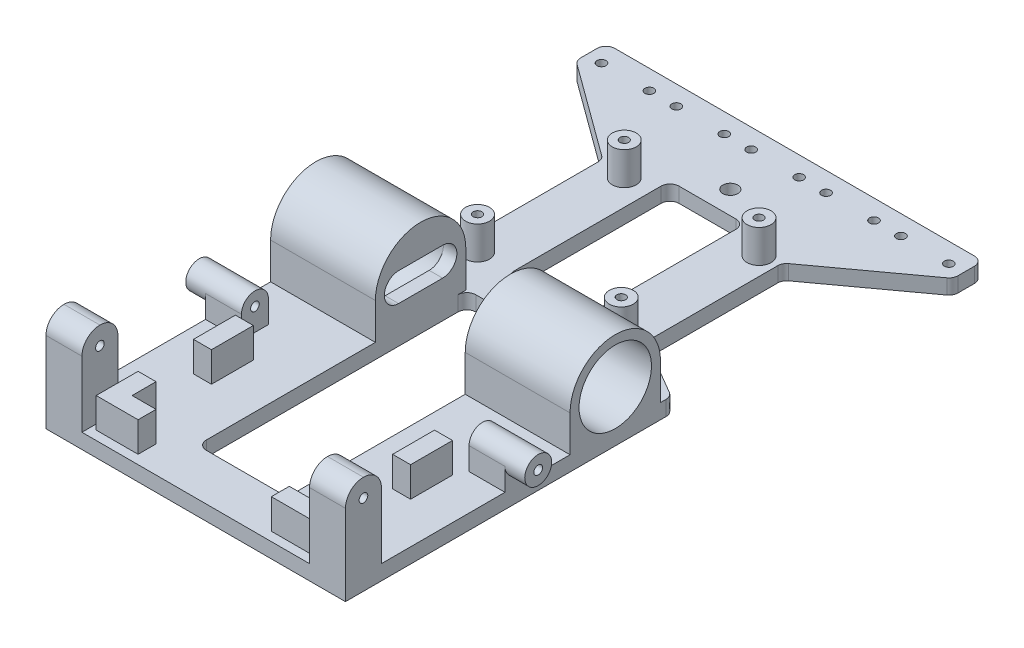
from build123d import *

# Parameters (mm, degrees)
SKETCH1_R             = 2.5
SKETCH1_W             = 30
SKETCH1_H             = 90
SKETCH1_W_2           = 25
SKETCH1_H_2           = 55
BOSS_EXTRUDE1_DEPTH   = 5
FILLET1_R             = 3
SKETCH3_W             = 35
SKETCH3_H             = 30.2
BOSS_EXTRUDE2_DEPTH   = 27.2
CUT_EXTRUDE1_DEPTH    = 35
SKETCH4_3_R           = 12.1
CUT_EXTRUDE2_DEPTH    = 30.5
CUT_EXTRUDE3_DEPTH    = 35
SKETCH6_W             = 12
SKETCH6_H             = 9
BOSS_EXTRUDE3_DEPTH   = 12
FILLET2_R             = 4.5
SKETCH9_R             = 4.5
BOSS_EXTRUDE5_DEPTH   = 6.6
SKETCH10_R            = 1.45
CUT_EXTRUDE5_DEPTH    = 18.6
FILLET2_OF_MIRROR11_R = 4.5
SKETCH11_W            = 12
SKETCH11_H            = 12
BOSS_EXTRUDE6_DEPTH   = 28
FILLET3_R             = 6
SKETCH12_R            = 1.45
CUT_EXTRUDE6_DEPTH    = 12
FILLET3_OF_MIRROR12_R = 6
SKETCH13_R            = 4
SKETCH13_R_2          = 1.45
BOSS_EXTRUDE7_DEPTH   = 11
BOSS_EXTRUDE8_DEPTH   = 10
SKETCH16_W            = 6
SKETCH16_H            = 14
BOSS_EXTRUDE9_DEPTH   = 10
CUT_EXTRUDE7_REACH    = 123.462
SKETCH17_R            = 1.5


with BuildPart() as part:
    # Sketch1 → Boss-Extrude1 (new body)
    with BuildSketch(Plane(origin=(0, 0, 0), x_dir=(1, 0, 0), z_dir=(0, 1, 0))):
        Polygon((-50, -100), (50, -100), (50, -50), (50, -35), (50, 8.781570318), (30, 20.44204843), (30, 65.896231008), (63, 90), (63, 100), (50, 100), (-50, 100), (-63, 100), (-63, 90), (-30, 65.896231008), (-30, 20.44204843), (-50, 8.781570318), (-50, -35), (-50, -50), align=None)
        with Locations(Location((0, 78.520352636, 0), (0, 0, 270))):
            Circle(SKETCH1_R, mode=Mode.SUBTRACT)
        with Locations((0, -39.461257299)):
            Rectangle(SKETCH1_W, SKETCH1_H, mode=Mode.SUBTRACT)
        with Locations((0, 43.381236072)):
            Rectangle(SKETCH1_W_2, SKETCH1_H_2, mode=Mode.SUBTRACT)
    extrude(amount=BOSS_EXTRUDE1_DEPTH)

    # Fillet1
    fillet1_edges = [part.edges().sort_by_distance(p)[0] for p in [
        (63, 2.5, -100),
        (63, 2.5, -90),
        (30, 2.5, -65.896231008),
        (30, 2.5, -20.44204843),
        (50, 2.5, -8.781570318),
        (-50, 2.5, -8.781570318),
        (-30, 2.5, -20.44204843),
        (-30, 2.5, -65.896231008),
        (-63, 2.5, -90),
        (-63, 2.5, -100),
        (15, 2.5, 84.461257299),
        (15, 2.5, -5.538742701),
        (-15, 2.5, -5.538742701),
        (-15, 2.5, 84.461257299),
        (12.5, 2.5, -15.881236072),
        (12.5, 2.5, -70.881236072),
        (-12.5, 2.5, -70.881236072),
        (-12.5, 2.5, -15.881236072),
    ]]
    fillet(fillet1_edges, radius=FILLET1_R)

    # Sketch3 → Boss-Extrude2 (add)
    with BuildSketch(Plane(origin=(0, 5, 0), x_dir=(1, 0, 0), z_dir=(0, 1, 0))):
        with Locations((-32.5, -9.9)):
            Rectangle(SKETCH3_W, SKETCH3_H)
    boss_extrude2 = extrude(amount=BOSS_EXTRUDE2_DEPTH)

    # Sketch4 → Cut-Extrude1 (cut)
    with BuildSketch(Plane.ZY.offset(50)):
        with BuildLine():
            Line((-5.2, 32.2), (-5.2, 17.1))
            ThreePointArc((-5.2, 17.1), (-0.777312396, 27.777312396), (9.9, 32.2))
            Line((9.9, 32.2), (-5.2, 32.2))
        make_face()
        with BuildLine():
            Line((25, 32.2), (9.9, 32.2))
            ThreePointArc((9.9, 32.2), (20.577312396, 27.777312396), (25, 17.1))
            Line((25, 17.1), (25, 32.2))
        make_face()
    cut_extrude1 = extrude(amount=-CUT_EXTRUDE1_DEPTH, mode=Mode.SUBTRACT)

    # Sketch4<3> → Cut-Extrude2 (cut)
    with BuildSketch(Plane.ZY.offset(50)):
        with Locations((9.9, 17.1)):
            Circle(SKETCH4_3_R)
    cut_extrude2 = extrude(amount=-CUT_EXTRUDE2_DEPTH, mode=Mode.SUBTRACT)

    # Sketch4<4> → Cut-Extrude3 (cut)
    with BuildSketch(Plane.ZY.offset(50)):
        with BuildLine():
            Line((2.55, 21.85), (17.25, 21.85))
            ThreePointArc((17.25, 21.85), (22, 17.1), (17.25, 12.35))
            Line((17.25, 12.35), (2.55, 12.35))
            ThreePointArc((2.55, 12.35), (-2.2, 17.1), (2.55, 21.85))
        make_face()
    cut_extrude3 = extrude(amount=-CUT_EXTRUDE3_DEPTH, mode=Mode.SUBTRACT)

    # Mirror9: Boss-Extrude2, Cut-Extrude1, Cut-Extrude2, Cut-Extrude3 across plane
    add(boss_extrude2.mirror(Plane(origin=(0, 0, 0), x_dir=(0, 0, 1), z_dir=(1, 0, 0))))
    add(cut_extrude1.mirror(Plane(origin=(0, 0, 0), x_dir=(0, 0, 1), z_dir=(1, 0, 0))), mode=Mode.SUBTRACT)
    add(cut_extrude2.mirror(Plane(origin=(0, 0, 0), x_dir=(0, 0, 1), z_dir=(1, 0, 0))), mode=Mode.SUBTRACT)
    add(cut_extrude3.mirror(Plane(origin=(0, 0, 0), x_dir=(0, 0, 1), z_dir=(1, 0, 0))), mode=Mode.SUBTRACT)

    # Sketch6 → Boss-Extrude3 (add)
    with BuildSketch(Plane(origin=(0, 5, 0), x_dir=(1, 0, 0), z_dir=(0, 1, 0))):
        with Locations((-44, -42.231514294)):
            Rectangle(SKETCH6_W, SKETCH6_H)
    boss_extrude3 = extrude(amount=BOSS_EXTRUDE3_DEPTH)

    # Fillet2
    fillet2_edges = [part.edges().sort_by_distance(p)[0] for p in [
        (-44, 17, 37.731514294),
        (-44, 17, 46.731514294),
    ]]
    fillet(fillet2_edges, radius=FILLET2_R - 0.0001)  # a hair under: the kernel refuses the full size

    # Sketch9 → Boss-Extrude5 (add)
    with BuildSketch(Plane.ZY.offset(50)):
        with Locations((42.231514294, 12.5)):
            Circle(SKETCH9_R)
    boss_extrude5 = extrude(amount=BOSS_EXTRUDE5_DEPTH)

    # Sketch10 → Cut-Extrude5 (cut)
    with BuildSketch(Plane.ZY.offset(56.6)):
        with Locations((42.231514294, 12.5)):
            Circle(SKETCH10_R)
    cut_extrude5 = extrude(amount=-CUT_EXTRUDE5_DEPTH, mode=Mode.SUBTRACT)

    # Mirror11: Boss-Extrude3, Boss-Extrude5, Cut-Extrude5 across plane
    add(boss_extrude3.mirror(Plane(origin=(0, 0, 0), x_dir=(0, 0, 1), z_dir=(1, 0, 0))))
    add(boss_extrude5.mirror(Plane(origin=(0, 0, 0), x_dir=(0, 0, 1), z_dir=(1, 0, 0))))
    add(cut_extrude5.mirror(Plane(origin=(0, 0, 0), x_dir=(0, 0, 1), z_dir=(1, 0, 0))), mode=Mode.SUBTRACT)

    # Fillet2 of Mirror11
    fillet2_of_mirror11_edges = [part.edges().sort_by_distance(p)[0] for p in [
        (44, 17, 37.731514294),
        (44, 17, 46.731514294),
    ]]
    fillet(fillet2_of_mirror11_edges, radius=FILLET2_OF_MIRROR11_R - 0.0001)  # a hair under: the kernel refuses the full size

    # Sketch11 → Boss-Extrude6 (add)
    with BuildSketch(Plane(origin=(0, 5, 0), x_dir=(1, 0, 0), z_dir=(0, 1, 0))):
        with Locations((-44, -94)):
            Rectangle(SKETCH11_W, SKETCH11_H)
    boss_extrude6 = extrude(amount=BOSS_EXTRUDE6_DEPTH)

    # Fillet3
    fillet3_edges = [part.edges().sort_by_distance(p)[0] for p in [
        (-44, 33, 88),
        (-44, 33, 100),
    ]]
    fillet(fillet3_edges, radius=FILLET3_R - 0.0001)  # a hair under: the kernel refuses the full size

    # Sketch12 → Cut-Extrude6 (cut)
    with BuildSketch(Plane.ZY.offset(50)):
        with Locations((94, 27)):
            Circle(SKETCH12_R)
    cut_extrude6 = extrude(amount=-CUT_EXTRUDE6_DEPTH, mode=Mode.SUBTRACT)

    # Mirror12: Boss-Extrude6, Cut-Extrude6 across plane
    add(boss_extrude6.mirror(Plane(origin=(0, 0, 0), x_dir=(0, 0, 1), z_dir=(1, 0, 0))))
    add(cut_extrude6.mirror(Plane(origin=(0, 0, 0), x_dir=(0, 0, 1), z_dir=(1, 0, 0))), mode=Mode.SUBTRACT)

    # Fillet3 of Mirror12
    fillet3_of_mirror12_edges = [part.edges().sort_by_distance(p)[0] for p in [
        (44, 33, 88),
        (44, 33, 100),
    ]]
    fillet(fillet3_of_mirror12_edges, radius=FILLET3_OF_MIRROR12_R - 0.0001)  # a hair under: the kernel refuses the full size

    # Sketch13 → Boss-Extrude7 (add)
    # profile 1 of 4: a face of its own
    with BuildSketch(Plane(origin=(0, 5, 0), x_dir=(1, 0, 0), z_dir=(0, 1, 0))):
        with Locations(Location((-23.995, 18.108314646, 0), (0, 0, 270))):
            Circle(SKETCH13_R)
        with Locations(Location((-23.995, 18.108314646, 0), (0, 0, 270))):
            Circle(SKETCH13_R_2, mode=Mode.SUBTRACT)
    # profile 2 of 4: a face of its own
    with BuildSketch(Plane(origin=(0, 5, 0), x_dir=(1, 0, 0), z_dir=(0, 1, 0))):
        with Locations(Location((24.005, 18.108314646, 0), (0, 0, 270))):
            Circle(SKETCH13_R)
        with Locations(Location((24.005, 18.108314646, 0), (0, 0, 270))):
            Circle(SKETCH13_R_2, mode=Mode.SUBTRACT)
    # profile 3 of 4: a face of its own
    with BuildSketch(Plane(origin=(0, 5, 0), x_dir=(1, 0, 0), z_dir=(0, 1, 0))):
        with Locations(Location((-20.995, 64.108314646, 0), (0, 0, 270))):
            Circle(SKETCH13_R)
        with Locations(Location((-20.995, 64.108314646, 0), (0, 0, 270))):
            Circle(SKETCH13_R_2, mode=Mode.SUBTRACT)
    # profile 4 of 4: a face of its own
    with BuildSketch(Plane(origin=(0, 5, 0), x_dir=(1, 0, 0), z_dir=(0, 1, 0))):
        with Locations(Location((24.005, 64.108314646, 0), (0, 0, 270))):
            Circle(SKETCH13_R)
        with Locations(Location((24.005, 64.108314646, 0), (0, 0, 270))):
            Circle(SKETCH13_R_2, mode=Mode.SUBTRACT)
    extrude(amount=BOSS_EXTRUDE7_DEPTH)

    # Sketch15 → Boss-Extrude8 (add)
    with BuildSketch(Plane(origin=(0, 5, 0), x_dir=(1, 0, 0), z_dir=(0, 1, 0))):
        Polygon((-30.25, -91), (-22.25, -91), (-22.25, -97), (-36.25, -97), (-36.25, -83), (-30.25, -83), align=None)
    boss_extrude8 = extrude(amount=BOSS_EXTRUDE8_DEPTH)

    # Mirror13: Boss-Extrude8 across plane
    add(boss_extrude8.mirror(Plane(origin=(0, 0, 0), x_dir=(0, 0, 1), z_dir=(1, 0, 0))))

    # Sketch16 → Boss-Extrude9 (add)
    with BuildSketch(Plane(origin=(0, 5, 0), x_dir=(1, 0, 0), z_dir=(0, 1, 0))):
        with Locations((-33.25, -57.5)):
            Rectangle(SKETCH16_W, SKETCH16_H)
    boss_extrude9 = extrude(amount=BOSS_EXTRUDE9_DEPTH)

    # Mirror14: Boss-Extrude9 across plane
    add(boss_extrude9.mirror(Plane(origin=(0, 0, 0), x_dir=(0, 0, 1), z_dir=(1, 0, 0))))

    # Sketch17 → Cut-Extrude7 (cut, up to next)
    with BuildSketch(Plane(origin=(0, 5, 0), x_dir=(1, 0, 0), z_dir=(0, 1, 0)), mode=Mode.PRIVATE) as cut_extrude7_sk1:
        with Locations(Location((-58, 93.5, 0), (0, 0, 270))):
            Circle(SKETCH17_R)
    cut_extrude7_tool1 = extrude(cut_extrude7_sk1.sketch, amount=-CUT_EXTRUDE7_REACH, mode=Mode.PRIVATE) & part.part
    # Sketch17 → Cut-Extrude7 (cut, up to next)
    with BuildSketch(Plane(origin=(0, 5, 0), x_dir=(1, 0, 0), z_dir=(0, 1, 0)), mode=Mode.PRIVATE) as cut_extrude7_sk2:
        with Locations(Location((-42, 93.5, 0), (0, 0, 270))):
            Circle(SKETCH17_R)
    cut_extrude7_tool2 = extrude(cut_extrude7_sk2.sketch, amount=-CUT_EXTRUDE7_REACH, mode=Mode.PRIVATE) & part.part
    # Sketch17 → Cut-Extrude7 (cut, up to next)
    with BuildSketch(Plane(origin=(0, 5, 0), x_dir=(1, 0, 0), z_dir=(0, 1, 0)), mode=Mode.PRIVATE) as cut_extrude7_sk3:
        with Locations(Location((-33, 93.5, 0), (0, 0, 270))):
            Circle(SKETCH17_R)
    cut_extrude7_tool3 = extrude(cut_extrude7_sk3.sketch, amount=-CUT_EXTRUDE7_REACH, mode=Mode.PRIVATE) & part.part
    # Sketch17 → Cut-Extrude7 (cut, up to next)
    with BuildSketch(Plane(origin=(0, 5, 0), x_dir=(1, 0, 0), z_dir=(0, 1, 0)), mode=Mode.PRIVATE) as cut_extrude7_sk4:
        with Locations(Location((-17, 93.5, 0), (0, 0, 270))):
            Circle(SKETCH17_R)
    cut_extrude7_tool4 = extrude(cut_extrude7_sk4.sketch, amount=-CUT_EXTRUDE7_REACH, mode=Mode.PRIVATE) & part.part
    # Sketch17 → Cut-Extrude7 (cut, up to next)
    with BuildSketch(Plane(origin=(0, 5, 0), x_dir=(1, 0, 0), z_dir=(0, 1, 0)), mode=Mode.PRIVATE) as cut_extrude7_sk5:
        with Locations(Location((-8, 93.5, 0), (0, 0, 270))):
            Circle(SKETCH17_R)
    cut_extrude7_tool5 = extrude(cut_extrude7_sk5.sketch, amount=-CUT_EXTRUDE7_REACH, mode=Mode.PRIVATE) & part.part
    # Sketch17 → Cut-Extrude7 (cut, up to next)
    with BuildSketch(Plane(origin=(0, 5, 0), x_dir=(1, 0, 0), z_dir=(0, 1, 0)), mode=Mode.PRIVATE) as cut_extrude7_sk6:
        with Locations(Location((8, 93.5, 0), (0, 0, 270))):
            Circle(SKETCH17_R)
    cut_extrude7_tool6 = extrude(cut_extrude7_sk6.sketch, amount=-CUT_EXTRUDE7_REACH, mode=Mode.PRIVATE) & part.part
    # Sketch17 → Cut-Extrude7 (cut, up to next)
    with BuildSketch(Plane(origin=(0, 5, 0), x_dir=(1, 0, 0), z_dir=(0, 1, 0)), mode=Mode.PRIVATE) as cut_extrude7_sk7:
        with Locations(Location((17, 93.5, 0), (0, 0, 270))):
            Circle(SKETCH17_R)
    cut_extrude7_tool7 = extrude(cut_extrude7_sk7.sketch, amount=-CUT_EXTRUDE7_REACH, mode=Mode.PRIVATE) & part.part
    # Sketch17 → Cut-Extrude7 (cut, up to next)
    with BuildSketch(Plane(origin=(0, 5, 0), x_dir=(1, 0, 0), z_dir=(0, 1, 0)), mode=Mode.PRIVATE) as cut_extrude7_sk8:
        with Locations(Location((33, 93.5, 0), (0, 0, 270))):
            Circle(SKETCH17_R)
    cut_extrude7_tool8 = extrude(cut_extrude7_sk8.sketch, amount=-CUT_EXTRUDE7_REACH, mode=Mode.PRIVATE) & part.part
    # Sketch17 → Cut-Extrude7 (cut, up to next)
    with BuildSketch(Plane(origin=(0, 5, 0), x_dir=(1, 0, 0), z_dir=(0, 1, 0)), mode=Mode.PRIVATE) as cut_extrude7_sk9:
        with Locations(Location((42, 93.5, 0), (0, 0, 270))):
            Circle(SKETCH17_R)
    cut_extrude7_tool9 = extrude(cut_extrude7_sk9.sketch, amount=-CUT_EXTRUDE7_REACH, mode=Mode.PRIVATE) & part.part
    # Sketch17 → Cut-Extrude7 (cut, up to next)
    with BuildSketch(Plane(origin=(0, 5, 0), x_dir=(1, 0, 0), z_dir=(0, 1, 0)), mode=Mode.PRIVATE) as cut_extrude7_sk10:
        with Locations(Location((58, 93.5, 0), (0, 0, 270))):
            Circle(SKETCH17_R)
    cut_extrude7_tool10 = extrude(cut_extrude7_sk10.sketch, amount=-CUT_EXTRUDE7_REACH, mode=Mode.PRIVATE) & part.part
    add(cut_extrude7_tool1.solids().sort_by_distance((-58, 5, -93.5))[0], mode=Mode.SUBTRACT)
    add(cut_extrude7_tool2.solids().sort_by_distance((-42, 5, -93.5))[0], mode=Mode.SUBTRACT)
    add(cut_extrude7_tool3.solids().sort_by_distance((-33, 5, -93.5))[0], mode=Mode.SUBTRACT)
    add(cut_extrude7_tool4.solids().sort_by_distance((-17, 5, -93.5))[0], mode=Mode.SUBTRACT)
    add(cut_extrude7_tool5.solids().sort_by_distance((-8, 5, -93.5))[0], mode=Mode.SUBTRACT)
    add(cut_extrude7_tool6.solids().sort_by_distance((8, 5, -93.5))[0], mode=Mode.SUBTRACT)
    add(cut_extrude7_tool7.solids().sort_by_distance((17, 5, -93.5))[0], mode=Mode.SUBTRACT)
    add(cut_extrude7_tool8.solids().sort_by_distance((33, 5, -93.5))[0], mode=Mode.SUBTRACT)
    add(cut_extrude7_tool9.solids().sort_by_distance((42, 5, -93.5))[0], mode=Mode.SUBTRACT)
    add(cut_extrude7_tool10.solids().sort_by_distance((58, 5, -93.5))[0], mode=Mode.SUBTRACT)


solid = part.part
